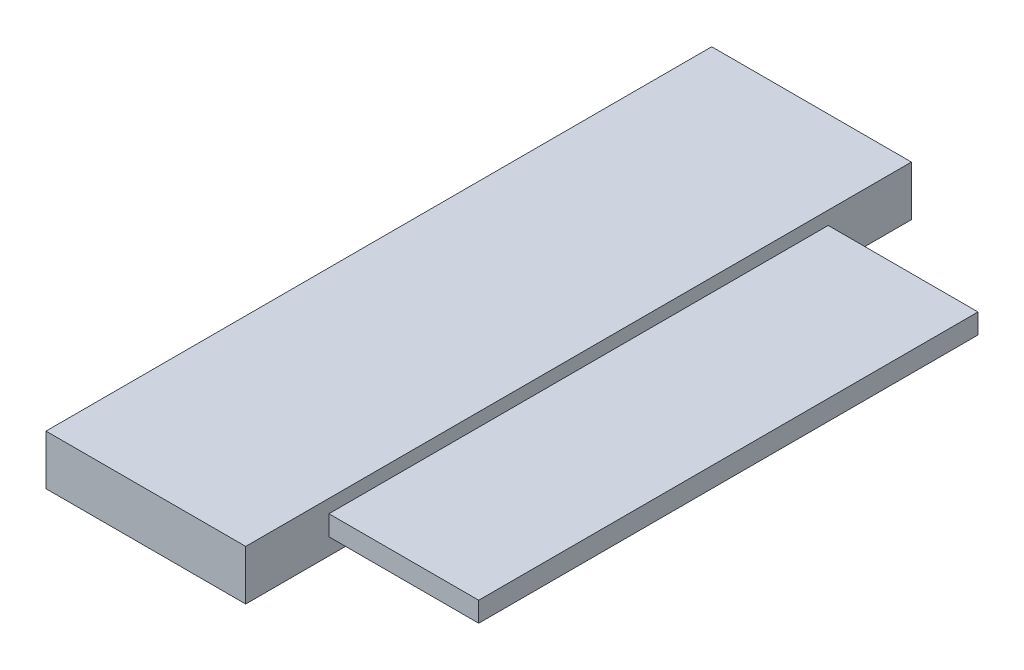
from build123d import *

# Parameters (mm, degrees)
SKETCH1_W               = 30
SKETCH1_H               = 100
BOSS_EXTRUDE1_DEPTH     = 3.75
BOSS_EXTRUDE2_START     = -5
BOSS_EXTRUDE2_OUTLINE_W = 22.5
BOSS_EXTRUDE2_OUTLINE_H = 75
BOSS_EXTRUDE2_DEPTH     = 3


# Read off the part's stored shape, not the designer's step: Boss-Extrude2
with BuildPart() as part:
    # Sketch1 → Boss-Extrude1 (new, symmetric)
    with BuildSketch(Plane(origin=(0, 0, 0), x_dir=(1, 0, 0), z_dir=(0, 1, 0))):
        with Locations((-15, 0)):
            Rectangle(SKETCH1_W, SKETCH1_H)
    extrude(amount=BOSS_EXTRUDE1_DEPTH, both=True)

    # Boss-Extrude2 outline → Boss-Extrude2 (add)
    with BuildSketch(Plane(origin=(0, 3.75, 0), x_dir=(1, 0, 0), z_dir=(0, 1, 0)).offset(BOSS_EXTRUDE2_START)):
        with Locations((11.25, 0)):
            Rectangle(BOSS_EXTRUDE2_OUTLINE_W, BOSS_EXTRUDE2_OUTLINE_H)
    extrude(amount=BOSS_EXTRUDE2_DEPTH)


solid = part.part
